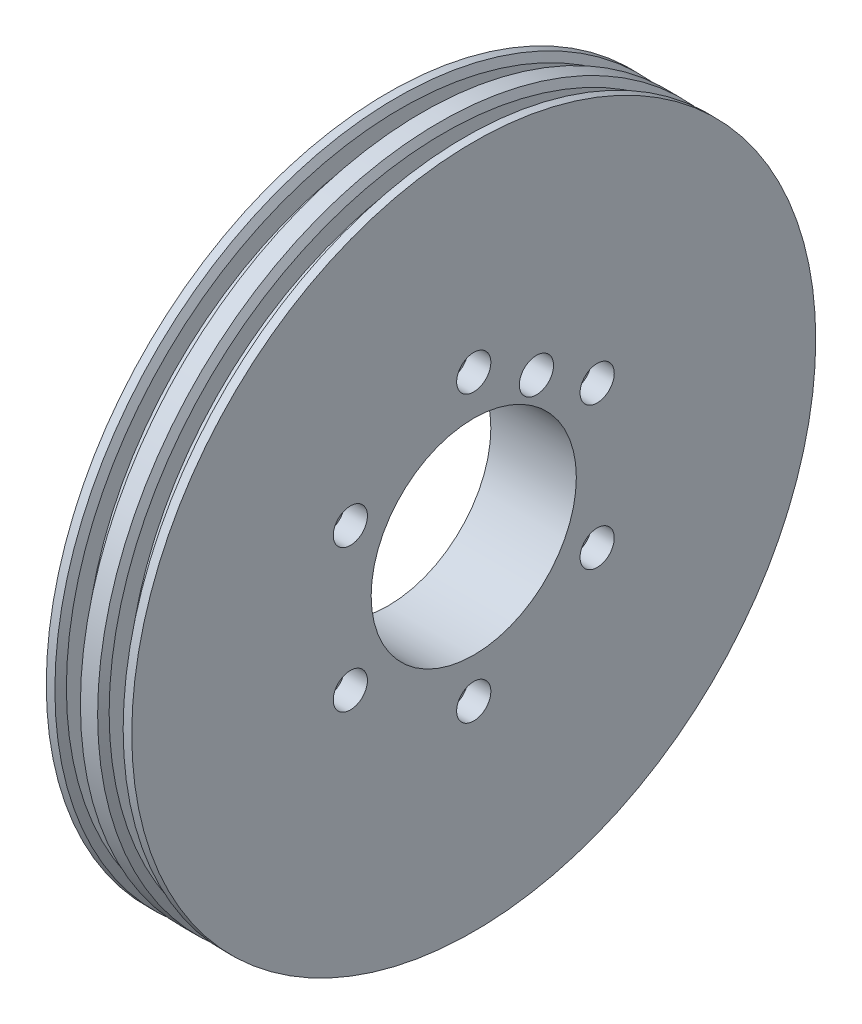
from build123d import *

# Parameters (mm, degrees)
SKETCH1_R           = 60
SKETCH1_R_2         = 18
BOSS_EXTRUDE1_DEPTH = 7.5
CUT_EXTRUDE2_REACH  = 88.168
SKETCH3_R           = 2
SKETCH4_R           = 34.5
SKETCH4_R_2         = 31.5
CUT_EXTRUDE3_DEPTH  = 3
SKETCH6_R           = 3
CUT_EXTRUDE4_DEPTH  = 4
CUT_EXTRUDE5_REACH  = 88.168
SKETCH7_R           = 3


with BuildPart() as part:
    # Sketch1 → Boss-Extrude1 (new, symmetric)
    with BuildSketch(Plane(origin=(0, 0, 0), x_dir=(0, 0, -1), z_dir=(1, 0, 0))):
        Circle(SKETCH1_R)
        Circle(SKETCH1_R_2, mode=Mode.SUBTRACT)
    extrude(amount=BOSS_EXTRUDE1_DEPTH, both=True)

    # Sketch3 → Cut-Extrude2 (cut, up to next)
    with BuildSketch(Plane(origin=(7.5, 0, 0), x_dir=(0, 0, -1), z_dir=(1, 0, 0)), mode=Mode.PRIVATE) as cut_extrude2_sk1:
        with Locations((0, 25)):
            Circle(SKETCH3_R)
    cut_extrude2_tool1 = extrude(cut_extrude2_sk1.sketch, amount=-CUT_EXTRUDE2_REACH, mode=Mode.PRIVATE) & part.part
    # Sketch3 → Cut-Extrude2 (cut, up to next)
    with BuildSketch(Plane(origin=(7.5, 0, 0), x_dir=(0, 0, -1), z_dir=(1, 0, 0)), mode=Mode.PRIVATE) as cut_extrude2_sk2:
        with Locations((21.650635095, 12.5)):
            Circle(SKETCH3_R)
    cut_extrude2_tool2 = extrude(cut_extrude2_sk2.sketch, amount=-CUT_EXTRUDE2_REACH, mode=Mode.PRIVATE) & part.part
    # Sketch3 → Cut-Extrude2 (cut, up to next)
    with BuildSketch(Plane(origin=(7.5, 0, 0), x_dir=(0, 0, -1), z_dir=(1, 0, 0)), mode=Mode.PRIVATE) as cut_extrude2_sk3:
        with Locations((21.650635095, -12.5)):
            Circle(SKETCH3_R)
    cut_extrude2_tool3 = extrude(cut_extrude2_sk3.sketch, amount=-CUT_EXTRUDE2_REACH, mode=Mode.PRIVATE) & part.part
    # Sketch3 → Cut-Extrude2 (cut, up to next)
    with BuildSketch(Plane(origin=(7.5, 0, 0), x_dir=(0, 0, -1), z_dir=(1, 0, 0)), mode=Mode.PRIVATE) as cut_extrude2_sk4:
        with Locations((0, -25)):
            Circle(SKETCH3_R)
    cut_extrude2_tool4 = extrude(cut_extrude2_sk4.sketch, amount=-CUT_EXTRUDE2_REACH, mode=Mode.PRIVATE) & part.part
    # Sketch3 → Cut-Extrude2 (cut, up to next)
    with BuildSketch(Plane(origin=(7.5, 0, 0), x_dir=(0, 0, -1), z_dir=(1, 0, 0)), mode=Mode.PRIVATE) as cut_extrude2_sk5:
        with Locations((-21.650635095, -12.5)):
            Circle(SKETCH3_R)
    cut_extrude2_tool5 = extrude(cut_extrude2_sk5.sketch, amount=-CUT_EXTRUDE2_REACH, mode=Mode.PRIVATE) & part.part
    # Sketch3 → Cut-Extrude2 (cut, up to next)
    with BuildSketch(Plane(origin=(7.5, 0, 0), x_dir=(0, 0, -1), z_dir=(1, 0, 0)), mode=Mode.PRIVATE) as cut_extrude2_sk6:
        with Locations((-21.650635095, 12.5)):
            Circle(SKETCH3_R)
    cut_extrude2_tool6 = extrude(cut_extrude2_sk6.sketch, amount=-CUT_EXTRUDE2_REACH, mode=Mode.PRIVATE) & part.part
    add(cut_extrude2_tool1.solids().sort_by_distance((7.5, 25, 0))[0], mode=Mode.SUBTRACT)
    add(cut_extrude2_tool2.solids().sort_by_distance((7.5, 12.5, -21.650635))[0], mode=Mode.SUBTRACT)
    add(cut_extrude2_tool3.solids().sort_by_distance((7.5, -12.5, -21.650635))[0], mode=Mode.SUBTRACT)
    add(cut_extrude2_tool4.solids().sort_by_distance((7.5, -25, 0))[0], mode=Mode.SUBTRACT)
    add(cut_extrude2_tool5.solids().sort_by_distance((7.5, -12.5, 21.650635))[0], mode=Mode.SUBTRACT)
    add(cut_extrude2_tool6.solids().sort_by_distance((7.5, 12.5, 21.650635))[0], mode=Mode.SUBTRACT)

    # Sketch4 → Cut-Extrude3 (cut)
    with BuildSketch(Plane.ZY.offset(7.5)):
        Circle(SKETCH4_R)
        Circle(SKETCH4_R_2, mode=Mode.SUBTRACT)
    extrude(amount=-CUT_EXTRUDE3_DEPTH, mode=Mode.SUBTRACT)

    # Sketch5 → Cut-Revolve2 (revolve, cut)
    with BuildSketch(Plane.XY):
        Polygon((5.25, 55.496030983), (2.25, 55.496030983), (2.25, 58.719065255), (1.224068359, 60.496030983), (2.25, 60.496030983), (5.25, 60.496030983), (6.275931641, 60.496030983), (5.25, 58.719065255), align=None)
        Polygon((-2.25, 58.719065255), (-1.224068359, 60.496030983), (-2.25, 60.496030983), (-5.25, 60.496030983), (-6.275931641, 60.496030983), (-5.25, 58.719065255), (-5.25, 55.496030983), (-2.25, 55.496030983), align=None)
    revolve(axis=Axis((7.5, 0, 0), (-1, 0, 0)), mode=Mode.SUBTRACT)

    # Sketch6 → Cut-Extrude4 (cut)
    with BuildSketch(Plane(origin=(7.5, 0, 0), x_dir=(0, 0, -1), z_dir=(1, 0, 0))):
        with Locations((0, 25)):
            Circle(SKETCH6_R)
        with Locations((21.650635095, 12.5)):
            Circle(SKETCH6_R)
        with Locations((21.650635095, -12.5)):
            Circle(SKETCH6_R)
        with Locations((0, -25)):
            Circle(SKETCH6_R)
        with Locations((-21.650635095, -12.5)):
            Circle(SKETCH6_R)
        with Locations((-21.650635095, 12.5)):
            Circle(SKETCH6_R)
    extrude(amount=-CUT_EXTRUDE4_DEPTH, mode=Mode.SUBTRACT)

    # Sketch7 → Cut-Extrude5 (cut, up to next)
    with BuildSketch(Plane.ZY.offset(7.5), mode=Mode.PRIVATE) as cut_extrude5_sk1:
        with Locations((-11, 19.052558883)):
            Circle(SKETCH7_R)
    cut_extrude5_tool1 = extrude(cut_extrude5_sk1.sketch, amount=-CUT_EXTRUDE5_REACH, mode=Mode.PRIVATE) & part.part
    add(cut_extrude5_tool1.solids().sort_by_distance((-7.5, 19.052559, -11))[0], mode=Mode.SUBTRACT)


solid = part.part
